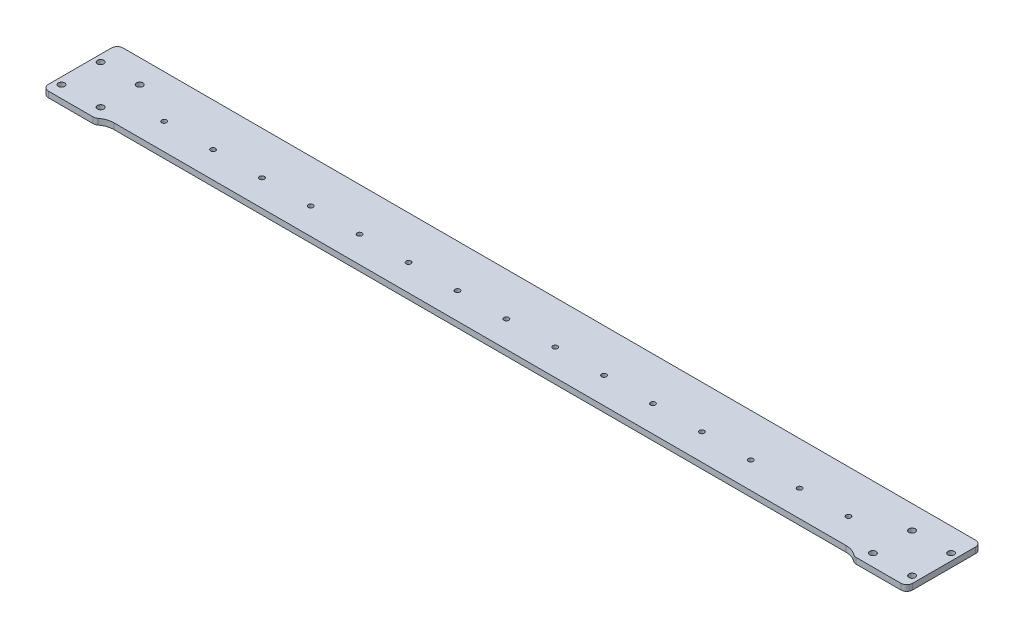
from build123d import *

# Parameters (mm, degrees)
BOSS_EXTRUDE1_DEPTH                   = 3
M3_CLEARANCE_HOLE1_D                  = 3.2
M3_CLEARANCE_HOLE1_CSINK_D            = 3.25
M3_CLEARANCE_HOLE1_CSINK_ANGLE        = 90
FILLET1_R                             = 10
FILLET2_R                             = 3
TAP_DRILL_FOR_M3X0_5_TAP2_D           = 2.5
TAP_DRILL_FOR_M3X0_5_TAP2_CSINK_D     = 2.55
TAP_DRILL_FOR_M3X0_5_TAP2_CSINK_ANGLE = 90
LPATTERN1_COUNT                       = 15
LPATTERN1_PITCH                       = 25


with BuildPart() as part:
    # Sketch1 → Boss-Extrude1 (new body)
    with BuildSketch(Plane(origin=(0, 0, 0), x_dir=(1, 0, 0), z_dir=(0, 1, 0))):
        Polygon((0, 0), (194, 0), (194, -2.7), (221, -2.7), (221, 29.7), (221, 35.5), (0, 35.5), (0, 29.7), align=None)
    extrude(amount=BOSS_EXTRUDE1_DEPTH)

    # M3 Clearance Hole1 (through all)
    with Locations(Plane(origin=(0, 3, 0), x_dir=(1, 0, 0), z_dir=(0, 1, 0))):
        with Locations((197.5, 23.5), (217.5, 3.5), (217.5, 23.5), (197.5, 3.5)):
            CounterSinkHole(M3_CLEARANCE_HOLE1_D / 2, M3_CLEARANCE_HOLE1_CSINK_D / 2, counter_sink_angle=M3_CLEARANCE_HOLE1_CSINK_ANGLE)

    # Fillet1
    # the kernel refuses this fillet: 10 mm, written as the material it adds along each edge
    with BuildSketch(Plane(origin=(194, 0, 0), x_dir=(-1, 0, 0), z_dir=(0, 1, 0))) as fillet1_piece_1:
        with BuildLine():
            CenterArc((6.83447145, 10), FILLET1_R, 226.886394054, 43.113605946)
            Line((0, 2.7), (-0.136689429, 2.554))
            ThreePointArc((-0.136689429, 2.554), (-0.2, 1.35), (-0.2, 0))
            Line((-0.2, 0), (0, -0.2))
            Line((0, -0.2), (6.83447145, -0.2))
            Line((6.83447145, -0.2), (6.83447145, 0))
        make_face()
    extrude(amount=3)

    # Fillet2
    fillet2_edges = [part.edges().sort_by_distance(p)[0] for p in [
        (221, 1.5, -35.5),
        (221, 1.5, 2.7),
        (194, 1.5, 2.7),
    ]]
    fillet(fillet2_edges, radius=FILLET2_R)

    # Mirror1: part across plane


with BuildPart() as part_1:
    add(part.part)
    add(part.part.mirror(Plane(origin=(0, 3, -35.5), x_dir=(0, 0, 1), z_dir=(1, 0, 0))))

    # Tap Drill for M3x0.5 Tap2 (through all)
    with Locations(Plane(origin=(0, 0, 0), x_dir=(-1, 0, 0), z_dir=(0, -1, 0))):
        with Locations((-175, 13.5)):
            tap_drill_for_m3x0_5_tap2 = CounterSinkHole(TAP_DRILL_FOR_M3X0_5_TAP2_D / 2, TAP_DRILL_FOR_M3X0_5_TAP2_CSINK_D / 2, counter_sink_angle=TAP_DRILL_FOR_M3X0_5_TAP2_CSINK_ANGLE)

    # LPattern1: Tap Drill for M3x0.5 Tap2 ×15
    with Locations(*[(-i * LPATTERN1_PITCH, 0, 0) for i in range(1, LPATTERN1_COUNT)]):
        add(tap_drill_for_m3x0_5_tap2, mode=Mode.SUBTRACT)


solid = part_1.part
